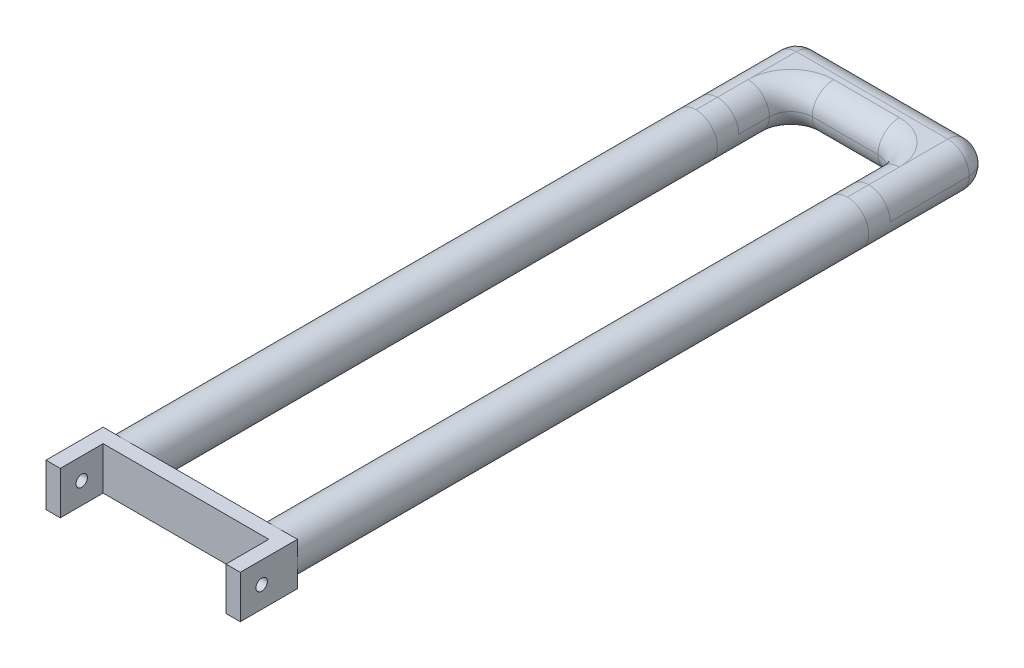
from build123d import *

# Parameters (mm, degrees)
SKETCH1_W               = 172.72
SKETCH1_H               = 38.1
BOSS_EXTRUDE1_DEPTH     = 12.7
SKETCH2_W               = 12.7
SKETCH2_H               = 38.1
BOSS_EXTRUDE2_DEPTH     = 38.1
SKETCH3_R               = 19.05
BOSS_EXTRUDE3_DEPTH     = 508
BOSS_EXTRUDE5_DEPTH     = 19.05
FILLET3_R               = 19.05
CUT_EXTRUDE1_DEPTH      = 638.105779031
CUT_EXTRUDE1_DEPTH_BACK = 638.105779031
SKETCH5_R               = 5.08


with BuildPart() as part:
    # Sketch1 → Boss-Extrude1 (new body)
    with BuildSketch(Plane.XY):
        Rectangle(SKETCH1_W, SKETCH1_H)
    extrude(amount=BOSS_EXTRUDE1_DEPTH)

    # Sketch2 → Boss-Extrude2 (add)
    with BuildSketch(Plane.XY.offset(12.7)):
        with Locations((-80.01, 0)):
            Rectangle(SKETCH2_W, SKETCH2_H)
        with Locations((80.01, 0)):
            Rectangle(SKETCH2_W, SKETCH2_H)
    extrude(amount=BOSS_EXTRUDE2_DEPTH)

    # Sketch3 → Boss-Extrude3 (add)
    with BuildSketch(Plane(origin=(0, 0, 0), x_dir=(-1, 0, 0), z_dir=(0, 0, -1))):
        with Locations(Location((-67.31, 0, 0), (0, 0, 180))):
            Circle(SKETCH3_R)
        with Locations((67.31, 0)):
            Circle(SKETCH3_R)
    extrude(amount=BOSS_EXTRUDE3_DEPTH)

    # Sketch4 → Boss-Extrude5 (add, symmetric)
    with BuildSketch(Plane(origin=(0, 0, 0), x_dir=(1, 0, 0), z_dir=(0, 1, 0))):
        Polygon((-86.36, 616.388246785), (86.36, 616.388246785), (86.36, 573.352506856), (86.36, 508), (48.26, 508), (48.26, 573.352506856), (-48.26, 573.352506856), (-48.26, 508), (-86.36, 508), (-86.36, 573.352506856), align=None)
    extrude(amount=BOSS_EXTRUDE5_DEPTH, both=True)

    # Fillet3
    fillet3_edges = [part.edges().sort_by_distance(p)[0] for p in [
        (86.36, -19.05, -562.194123393),
        (0, -19.05, -616.388246785),
        (86.36, 0, -616.388246785),
        (-86.36, -19.05, -562.194123393),
        (-86.36, 0, -616.388246785),
        (-48.26, -19.05, -540.676253428),
        (0, -19.05, -573.352506856),
        (-48.26, 0, -573.352506856),
        (48.26, -19.05, -540.676253428),
        (48.26, 0, -573.352506856),
        (86.36, 19.05, -562.194123393),
        (0, 19.05, -616.388246785),
        (-86.36, 19.05, -562.194123393),
        (-48.26, 19.05, -540.676253428),
        (0, 19.05, -573.352506856),
        (48.26, 19.05, -540.676253428),
    ]]
    fillet(fillet3_edges, radius=FILLET3_R - 0.0001)  # a hair under: the kernel refuses the full size

    # Sketch5 → Cut-Extrude1 (cut, two sides: drawn at the far end of the back side and taken through both)
    with BuildSketch(Plane(origin=(-73.66, 0, 0), x_dir=(0, 0, -1), z_dir=(1, 0, 0)).offset(-CUT_EXTRUDE1_DEPTH_BACK)):
        with Locations((-31.75, 0)):
            Circle(SKETCH5_R)
    extrude(amount=CUT_EXTRUDE1_DEPTH + CUT_EXTRUDE1_DEPTH_BACK, mode=Mode.SUBTRACT)


solid = part.part
